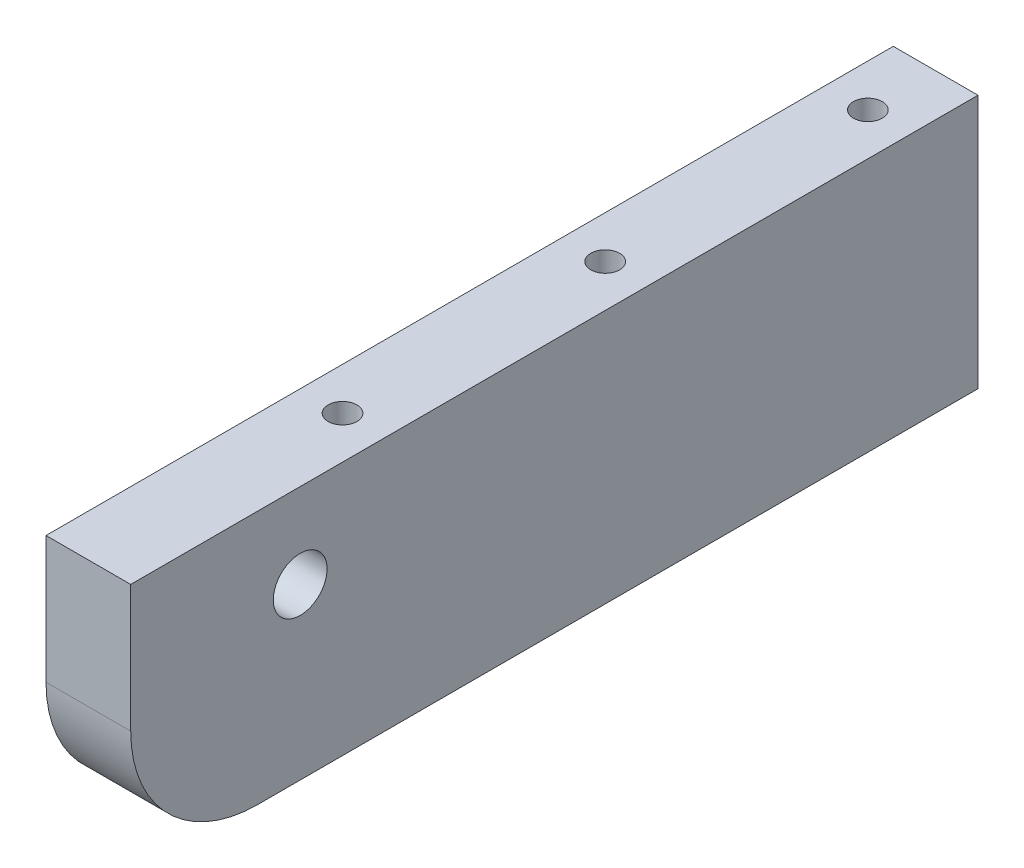
from build123d import *

# Parameters (mm, degrees)
SKETCH1_W                     = 100
SKETCH1_H                     = 30
SKETCH1_R                     = 3.175
BOSS_EXTRUDE1_DEPTH           = 10
FILLET1_R                     = 15
CBORE_FOR_M3_SHCS_D           = 3.4
CBORE_FOR_M3_SHCS_DEPTH       = 23
CBORE_FOR_M3_SHCS_CBORE_D     = 6.5
CBORE_FOR_M3_SHCS_CBORE_DEPTH = 3
CBORE_FOR_M3_SHCS_TIP         = 1.021463052


with BuildPart() as part:
    # Sketch1 → Boss-Extrude1 (new body)
    with BuildSketch(Plane(origin=(0, 0, 0), x_dir=(0, 0, -1), z_dir=(1, 0, 0))):
        Rectangle(SKETCH1_W, SKETCH1_H)
        with Locations((-30, 5)):
            Circle(SKETCH1_R, mode=Mode.SUBTRACT)
    extrude(amount=BOSS_EXTRUDE1_DEPTH)

    # Fillet1
    fillet1_edges = [part.edges().sort_by_distance(p)[0] for p in [
        (5, -15, 50),
    ]]
    fillet(fillet1_edges, radius=FILLET1_R)

    # CBORE for M3 SHCS
    with Locations(Plane(origin=(-726.293536786, 25, -1323.282701689), x_dir=(1, 0, 0), z_dir=(0, 1, 0))):
        with Locations((731.293536786, -1281.282701689), (731.293536786, -1343.282701689), (621.293536786, -1281.282701689), (621.293536786, -1365.282701689), (621.293536786, -1323.282701689), (731.293536786, -1312.282701689)):
            CounterBoreHole(CBORE_FOR_M3_SHCS_D / 2, CBORE_FOR_M3_SHCS_CBORE_D / 2, CBORE_FOR_M3_SHCS_CBORE_DEPTH, depth=CBORE_FOR_M3_SHCS_DEPTH)
            with Locations((0, 0, -(CBORE_FOR_M3_SHCS_DEPTH + CBORE_FOR_M3_SHCS_TIP / 2))):  # 118° drill point
                Cone(0, CBORE_FOR_M3_SHCS_D / 2, CBORE_FOR_M3_SHCS_TIP, mode=Mode.SUBTRACT)


solid = part.part
